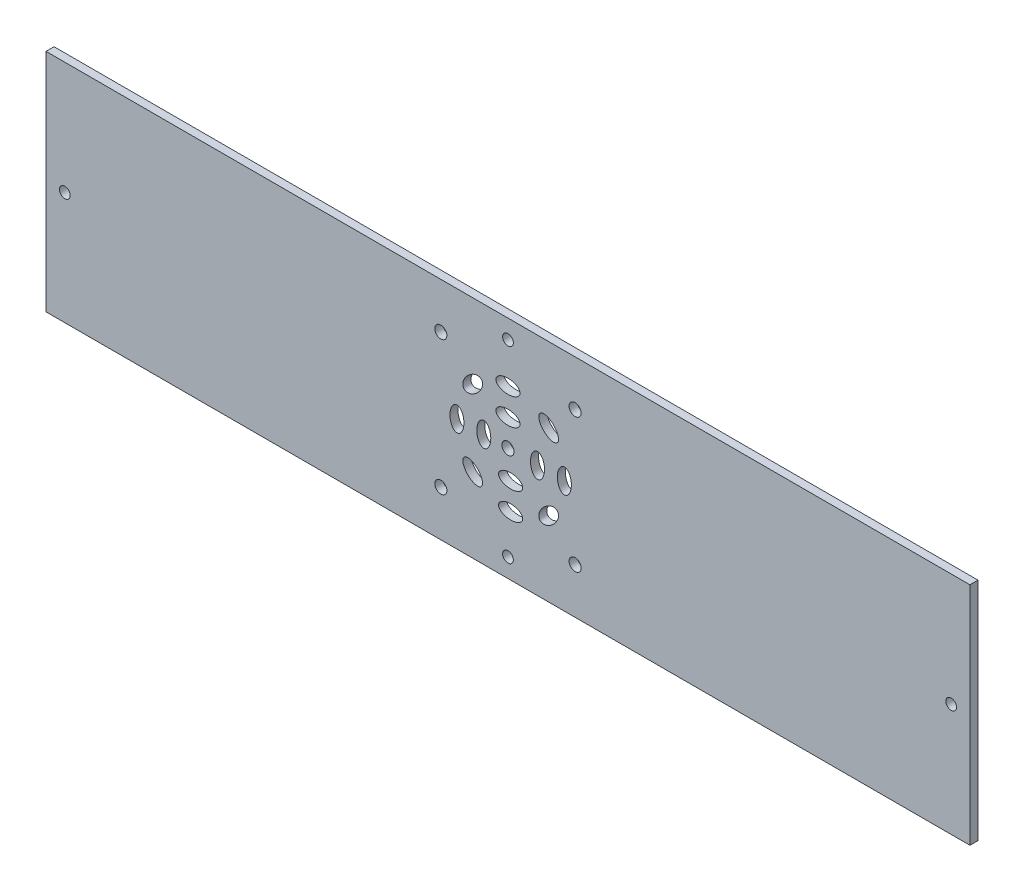
from build123d import *

# Parameters (mm, degrees)
SCHIZZO1_W                   = 344
SCHIZZO1_H                   = 84
SCHIZZO1_R                   = 2
SCHIZZO1_R_2                 = 2.25
SCHIZZO1_RX                  = 4.5
SCHIZZO1_RY                  = 2.6
ESTRUSIONE_ESTRUSIONE1_DEPTH = 3


with BuildPart() as part:
    # Schizzo1 → Estrusione-Estrusione1 (new body)
    with BuildSketch(Plane.XY):
        with Locations((172, 42)):
            Rectangle(SCHIZZO1_W, SCHIZZO1_H)
        with Locations((7, 42)):
            Circle(SCHIZZO1_R, mode=Mode.SUBTRACT)
        with Locations((172, 77)):
            Circle(SCHIZZO1_R, mode=Mode.SUBTRACT)
        with Locations((172, 7)):
            Circle(SCHIZZO1_R, mode=Mode.SUBTRACT)
        with Locations((337, 42)):
            Circle(SCHIZZO1_R, mode=Mode.SUBTRACT)
        with Locations((172, 42)):
            Circle(SCHIZZO1_R_2, mode=Mode.SUBTRACT)
        with Locations((147, 67)):
            Circle(SCHIZZO1_R_2, mode=Mode.SUBTRACT)
        with Locations((147, 17)):
            Circle(SCHIZZO1_R_2, mode=Mode.SUBTRACT)
        with Locations((197, 17)):
            Circle(SCHIZZO1_R_2, mode=Mode.SUBTRACT)
        with Locations((197, 67)):
            Circle(SCHIZZO1_R_2, mode=Mode.SUBTRACT)
        with Locations(Location((172, 52), (0, 0, -180))):
            Ellipse(SCHIZZO1_RX, SCHIZZO1_RY, mode=Mode.SUBTRACT)
        with Locations(Location((183, 42), (0, 0, -90))):
            Ellipse(SCHIZZO1_RX, SCHIZZO1_RY, mode=Mode.SUBTRACT)
        with Locations(Location((173, 32), (0, 0, 180))):
            Ellipse(SCHIZZO1_RX, SCHIZZO1_RY, mode=Mode.SUBTRACT)
        with Locations(Location((163, 42), (0, 0, 90))):
            Ellipse(SCHIZZO1_RX, SCHIZZO1_RY, mode=Mode.SUBTRACT)
        with Locations(Location((172, 62), (0, 0, 180))):
            Ellipse(SCHIZZO1_RX, SCHIZZO1_RY, mode=Mode.SUBTRACT)
        with Locations(Location((187.142135624, 56.142135624), (0, 0, -45))):
            Ellipse(SCHIZZO1_RX, SCHIZZO1_RY, mode=Mode.SUBTRACT)
        with Locations(Location((193, 42), (0, 0, -90))):
            Ellipse(SCHIZZO1_RX, SCHIZZO1_RY, mode=Mode.SUBTRACT)
        with Locations(Location((187.142135624, 27.857864376), (0, 0, -135))):
            Ellipse(SCHIZZO1_RX, SCHIZZO1_RY, mode=Mode.SUBTRACT)
        with Locations(Location((173, 22), (0, 0, 180))):
            Ellipse(SCHIZZO1_RX, SCHIZZO1_RY, mode=Mode.SUBTRACT)
        with Locations(Location((158.857864376, 27.857864376), (0, 0, 135))):
            Ellipse(SCHIZZO1_RX, SCHIZZO1_RY, mode=Mode.SUBTRACT)
        with Locations(Location((153, 42), (0, 0, 90))):
            Ellipse(SCHIZZO1_RX, SCHIZZO1_RY, mode=Mode.SUBTRACT)
        with Locations(Location((158.857864376, 56.142135624), (0, 0, 45))):
            Ellipse(SCHIZZO1_RX, SCHIZZO1_RY, mode=Mode.SUBTRACT)
    extrude(amount=ESTRUSIONE_ESTRUSIONE1_DEPTH)


solid = part.part
